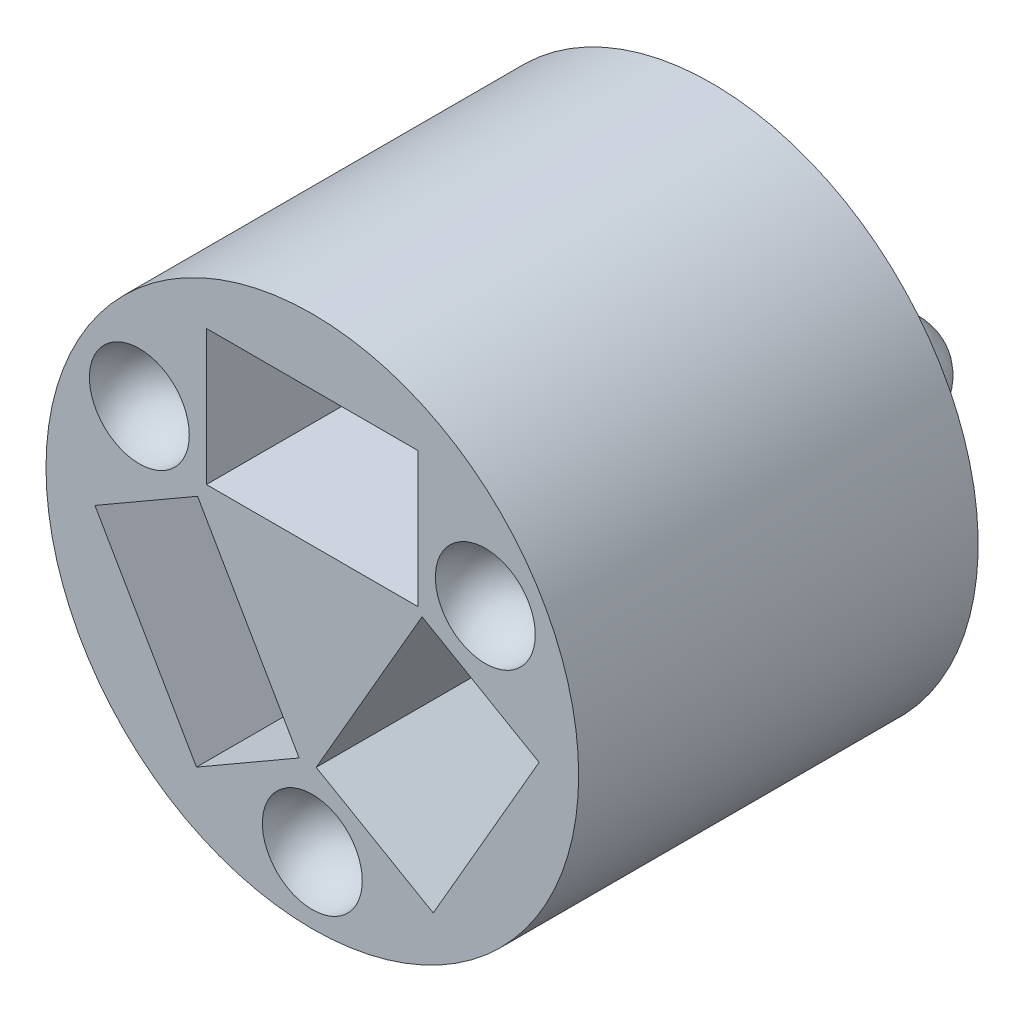
from build123d import *

# Parameters (mm, degrees)
SKETCH1_R           = 4
SKETCH1_W           = 3.18
SKETCH1_H           = 2.03
BOSS_EXTRUDE1_DEPTH = 5
BOSS_EXTRUDE3_START = 1
SKETCH4_R           = 4
SKETCH4_R_2         = 0.635
BOSS_EXTRUDE3_DEPTH = 1
SKETCH2_R           = 0.725
BOSS_EXTRUDE2_DEPTH = 0.725
FILLET2_R           = 0.725
SKETCH3_R           = 0.75
CUT_EXTRUDE2_DEPTH  = 0.75
FILLET3_R           = 0.75


with BuildPart() as part:
    # Sketch1 → Boss-Extrude1 (new body)
    with BuildSketch(Plane.XY):
        Circle(SKETCH1_R)
        Polygon((3.406066592, -0.130519608), (1.648035023, 0.884480392), (0.058035023, -1.869480392), (1.816066592, -2.884480392), align=None, mode=Mode.SUBTRACT)
        with Locations((0, 2)):
            Rectangle(SKETCH1_W, SKETCH1_H, mode=Mode.SUBTRACT)
        Polygon((-1.740313417, -2.765688741), (-0.198788198, -1.875688741), (-1.723788198, 0.765688741), (-3.265313417, -0.124311259), align=None, mode=Mode.SUBTRACT)
    extrude(amount=BOSS_EXTRUDE1_DEPTH)

    # Sketch4 → Boss-Extrude3 (add)
    with BuildSketch(Plane(origin=(0, 0, 0), x_dir=(-1, 0, 0), z_dir=(0, 0, -1)).offset(BOSS_EXTRUDE3_START)):
        Circle(SKETCH4_R)
        with Locations((0, 2)):
            Circle(SKETCH4_R_2, mode=Mode.SUBTRACT)
        with Locations((1.732050808, -1)):
            Circle(SKETCH4_R_2, mode=Mode.SUBTRACT)
        with Locations((-1.732050808, -1)):
            Circle(SKETCH4_R_2, mode=Mode.SUBTRACT)
    extrude(amount=-BOSS_EXTRUDE3_DEPTH)

    # Sketch2 → Boss-Extrude2 (add)
    with BuildSketch(Plane(origin=(0, 0, -1), x_dir=(-1, 0, 0), z_dir=(0, 0, -1))):
        with Locations((0, -3)):
            Circle(SKETCH2_R)
        with Locations((-2.598076211, 1.5)):
            Circle(SKETCH2_R)
        with Locations((2.598076211, 1.5)):
            Circle(SKETCH2_R)
    extrude(amount=BOSS_EXTRUDE2_DEPTH)

    # Fillet2
    fillet2_edges = [part.edges().sort_by_distance(p)[0] for p in [
        (0.725, -3, -1.725),
        (3.323076211, 1.5, -1.725),
        (-1.873076211, 1.5, -1.725),
    ]]
    fillet(fillet2_edges, radius=FILLET2_R - 0.0001)  # a hair under: the kernel refuses the full size

    # Sketch3 → Cut-Extrude2 (cut)
    with BuildSketch(Plane.XY.offset(5)):
        with Locations((0, -3)):
            Circle(SKETCH3_R)
        with Locations((-2.598076211, 1.5)):
            Circle(SKETCH3_R)
        with Locations((2.598076211, 1.5)):
            Circle(SKETCH3_R)
    extrude(amount=-CUT_EXTRUDE2_DEPTH, mode=Mode.SUBTRACT)

    # Fillet3
    fillet3_edges = [part.edges().sort_by_distance(p)[0] for p in [
        (-0.75, -3, 4.25),
        (-3.348076211, 1.5, 4.25),
        (1.848076211, 1.5, 4.25),
    ]]
    fillet(fillet3_edges, radius=FILLET3_R - 0.0001)  # a hair under: the kernel refuses the full size


solid = part.part
